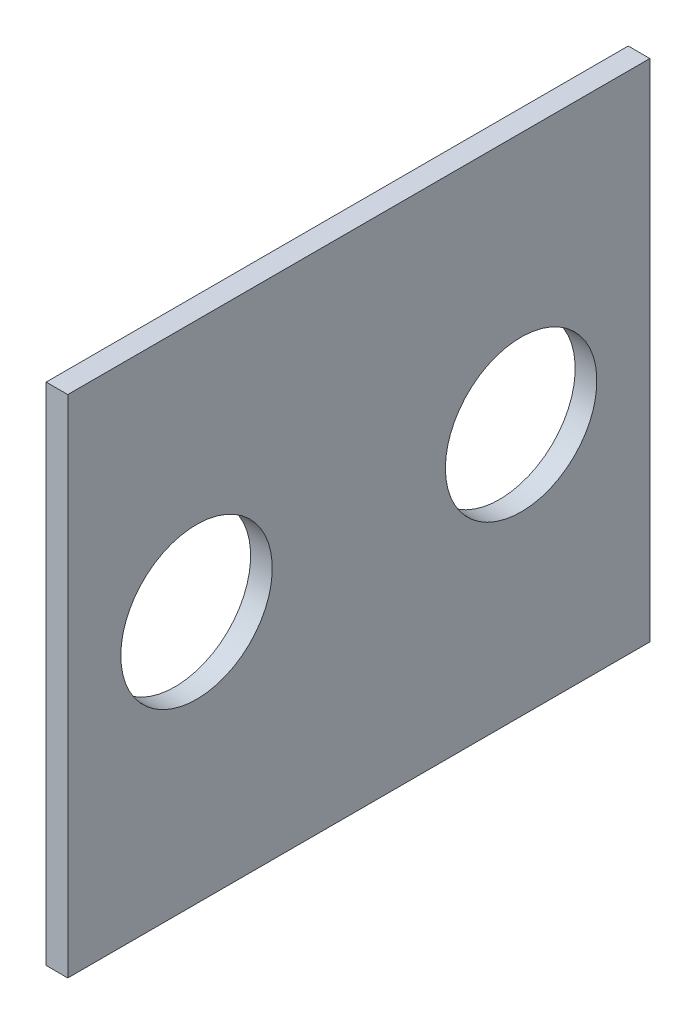
from build123d import *

# Parameters (mm, degrees)
FLANGE_BASE1_START     = -0.5
FLANGE_BASE1_OUTLINE_W = 26.9
FLANGE_BASE1_OUTLINE_H = 23.35
FLANGE_BASE1_DEPTH     = 1
ESBO_O2_R              = 3.5
CORTE_EXTRUS_O1_DEPTH  = 1


# Read off the part's stored shape, not the designer's step: Flange-base1
with BuildPart() as part:
    # Flange-base1 outline → Flange-base1 (new body)
    with BuildSketch(Plane(origin=(0, 0, 0), x_dir=(0, 0, -1), z_dir=(1, 0, 0)).offset(FLANGE_BASE1_START)):
        Rectangle(FLANGE_BASE1_OUTLINE_W, FLANGE_BASE1_OUTLINE_H)
    extrude(amount=FLANGE_BASE1_DEPTH)

    # Esboço2 → Corte-extrusão1 (cut)
    with BuildSketch(Plane.ZY.offset(0.5)):
        with Locations((-7.5, 0)):
            Circle(ESBO_O2_R)
        with Locations((7.5, 0)):
            Circle(ESBO_O2_R)
    extrude(amount=-CORTE_EXTRUS_O1_DEPTH, mode=Mode.SUBTRACT)


solid = part.part
